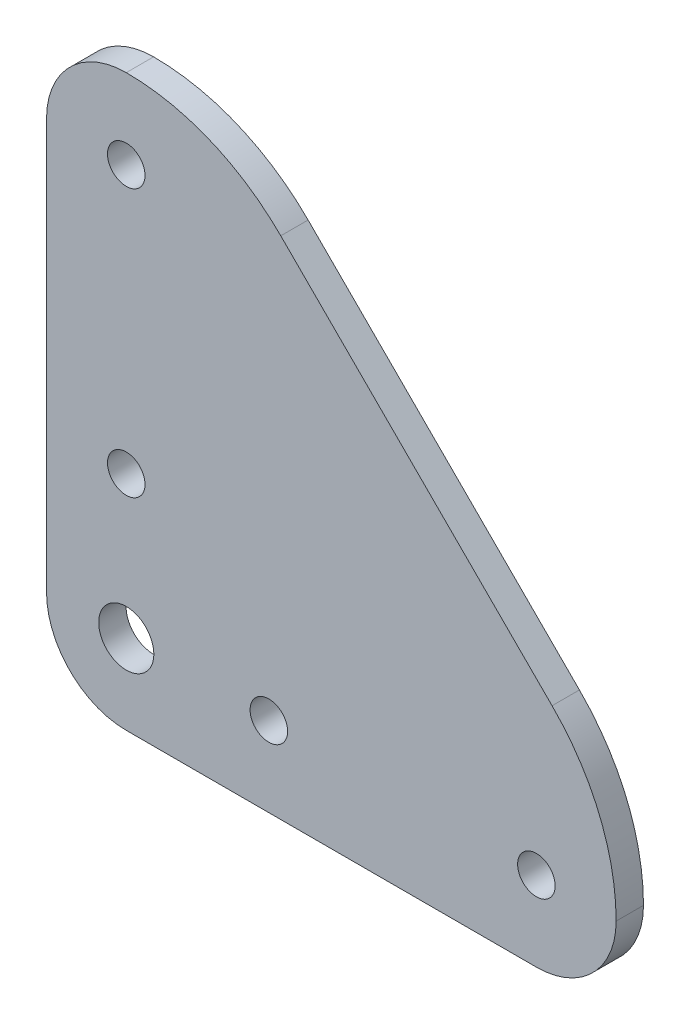
from build123d import *

# Parameters (mm, degrees)
SKETCH1_R           = 6.049999999999999
SKETCH1_R_2         = 4.118749999999998
SKETCH1_R_3         = 4.118750000000009
SKETCH1_R_4         = 4.118750000000003
SKETCH1_R_5         = 4.11875000000001
BOSS_EXTRUDE1_DEPTH = 3
FILLET1_R           = 21.5
FILLET2_R           = 52
CUT_EXTRUDE1_DEPTH  = 189.18607812481773


with BuildPart() as part:
    # Sketch1 → Boss-Extrude1 (new, symmetric)
    with BuildSketch(Plane.XY):
        Polygon((0, 0), (0, 133), (42.999999999999986, 133), (133, 42.99999999999999), (133, 9.06e-15), align=None)
        with Locations((21.5, 21.499999999999993)):
            Circle(SKETCH1_R, mode=Mode.SUBTRACT)
        with Locations((21.5, 111.50000000000001)):
            Circle(SKETCH1_R_2, mode=Mode.SUBTRACT)
        with Locations((111.50000000000001, 21.5)):
            Circle(SKETCH1_R_3, mode=Mode.SUBTRACT)
        with Locations((21.5, 52.78839999999999)):
            Circle(SKETCH1_R_4, mode=Mode.SUBTRACT)
        with Locations((52.788399999999996, 21.499999999999986)):
            Circle(SKETCH1_R_5, mode=Mode.SUBTRACT)
    extrude(amount=BOSS_EXTRUDE1_DEPTH, both=True)

    # Fillet1
    fillet1_edges = [part.edges().sort_by_distance(p)[0] for p in [
        (0, 0, 0),
        (0, 133, 0),
        (133, 9.06e-15, 0),
    ]]
    fillet(fillet1_edges, radius=FILLET1_R)

    # Fillet2
    # the kernel refuses this fillet: 52 mm, written as the material it takes off along each edge
    with BuildSketch(Plane(origin=(133, 43, -56.84767436170304), x_dir=(-0.7071067811865476, 0.7071067811865476, 0), z_dir=(0, 0, 1))) as fillet2_piece_1:
        with BuildLine():
            CenterArc((21.539069744681207, 52.00000000000001), FILLET2_R, 225.07350833515432, 44.926491664845685)
            Line((-15.183278672480162, 15.183303696167892), (-18.855513514196304, 11.501634065784673))
            ThreePointArc((-18.855513514196304, 11.501634065784673), (-18.87975105768081, 11.52584053334073), (-3.6769552621700394, -3.6769552621700394))
            Line((-3.6769552621700394, -3.6769552621700394), (-4.9e-15, -5.200000000000005))
            Line((-4.9e-15, -5.200000000000005), (21.539069744681218, -5.199999999999996))
            Line((21.539069744681218, -5.199999999999996), (21.539069744681214, 4.7e-16))
        make_face()
    extrude(amount=113.69534872340608, mode=Mode.SUBTRACT)
    with BuildSketch(Plane(origin=(42.999999999999986, 133, 56.847674361702985), x_dir=(-0.9999999999996605, -8.240534738615283e-07, 0), z_dir=(0, 0, -1))) as fillet2_piece_2:
        with BuildLine():
            CenterArc((21.539173195539043, -51.9999571492017), FILLET2_R, 90.07355554994047, 44.926491664845685)
            Line((-15.230409726226513, -15.230434827591285), (-18.90736801840307, -11.55348259543025))
            Line((-18.90736801840307, -11.55348259543025), (-3.676958292176556, 3.6769522321610486))
            Line((-3.676958292176556, 3.6769522321610486), (-4.28507806408e-06, 5.199999999998223))
            ThreePointArc((-4.28507806408e-06, 5.199999999998223), (21.499995714914625, 5.200017717147912), (21.46574062621809, 5.1999957149201785))
            Line((21.46574062621809, 5.1999957149201785), (21.472416314338172, 0))
        make_face()
    extrude(amount=113.69534872340597, mode=Mode.SUBTRACT)

    # Sketch2 → Cut-Extrude1 (cut, through all)
    with BuildSketch(Plane.XY.offset(3)):
        with BuildLine():
            Line((117.76956733680983, 58.23043266319015), (58.23043266319017, 117.76956733680981))
            ThreePointArc((58.23043266319017, 117.76956733680981), (41.3784881824358, 129.03426172642116), (21.499999999999996, 133))
            ThreePointArc((21.499999999999996, 133), (6.2972042044892405, 126.70279579551078), (3.47e-15, 111.50000000000001))
            Line((3.47e-15, 111.50000000000001), (0, 21.5))
            ThreePointArc((0, 21.5), (6.297204204489223, 6.297204204489235), (21.49999999999999, 3.47e-15))
            Line((21.49999999999999, 3.47e-15), (111.50000000000001, 1.041e-14))
            ThreePointArc((111.50000000000001, 1.041e-14), (126.70279579551078, 6.297204204489239), (133, 21.500000000000007))
            ThreePointArc((133, 21.500000000000007), (129.03426172642114, 41.37848818243579), (117.76956733680983, 58.23043266319015))
        make_face()
        with BuildLine():
            Line((114.94114021206362, 55.40200553844396), (55.402005538443966, 114.94114021206363))
            ThreePointArc((55.402005538443966, 114.94114021206363), (39.84708125964561, 125.33902242576387), (21.49854269401705, 128.9999999393217))
            ThreePointArc((21.49854269401705, 128.9999999393217), (9.12511610449009, 123.87385342456624), (4.0000000000000036, 111.50000000000001))
            Line((4.0000000000000036, 111.50000000000001), (4, 21.500000000000004))
            ThreePointArc((4, 21.500000000000004), (9.125631329235414, 9.125631329235425), (21.499999999999996, 4.0000000000000036))
            Line((21.499999999999996, 4.0000000000000036), (111.50000000000001, 4.000000000000011))
            ThreePointArc((111.50000000000001, 4.000000000000011), (123.8738534245646, 9.125116104488455), (128.9999999393217, 21.49854269401244))
            ThreePointArc((128.9999999393217, 21.49854269401244), (125.33902242576474, 39.847081259643474), (114.94114021206362, 55.40200553844396))
        make_face(mode=Mode.SUBTRACT)
    extrude(amount=-CUT_EXTRUDE1_DEPTH, mode=Mode.SUBTRACT)


with BuildPart() as cut_extrude1_kept_piece:
    # of the separate pieces the step leaves, the one the design keeps (cut_extrude1_pieces_kept)
    add(part.part.solids().sort_by_distance((128.999999939, 21.498542694, -3))[0])


solid = cut_extrude1_kept_piece.part
